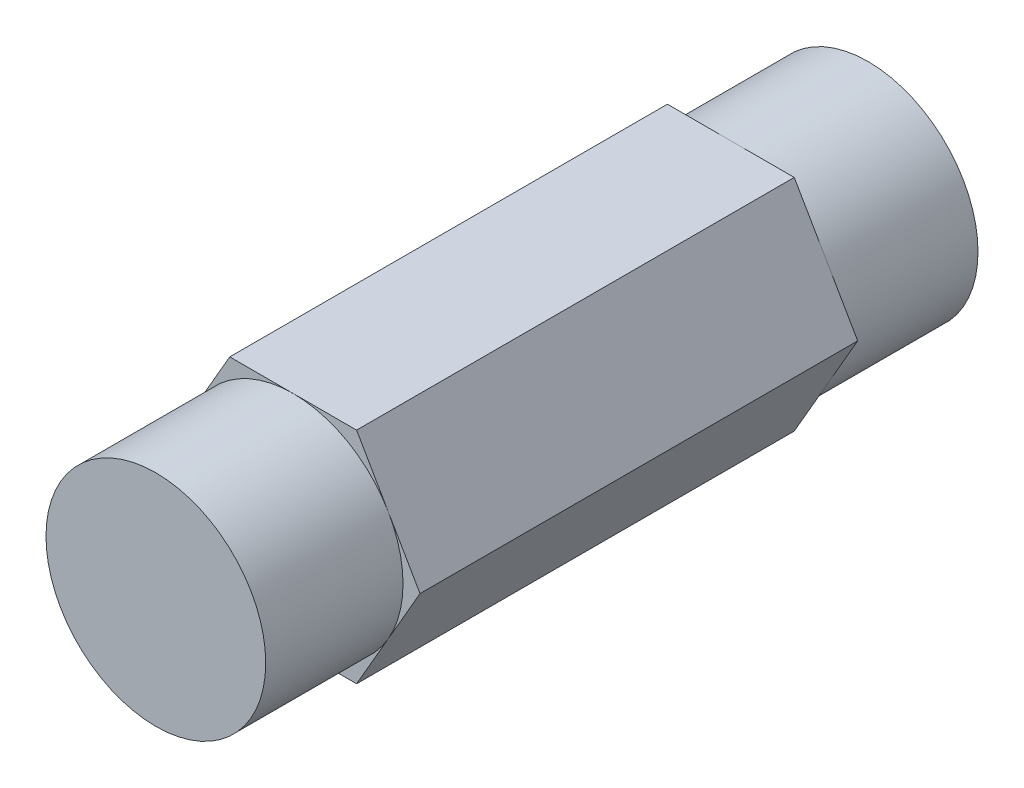
from build123d import *

# Parameters (mm, degrees)
SKETCH1_R           = 6.35
BOSS_EXTRUDE1_DEPTH = 7.9375
BOSS_EXTRUDE2_DEPTH = 25.2984
SKETCH3_R           = 6.35
BOSS_EXTRUDE3_DEPTH = 7.9375


with BuildPart() as part:
    # Sketch1 → Boss-Extrude1 (new body)
    with BuildSketch(Plane.XY):
        Circle(SKETCH1_R)
    extrude(amount=BOSS_EXTRUDE1_DEPTH)

    # Sketch2 → Boss-Extrude2 (add)
    with BuildSketch(Plane.XY.offset(7.9375)):
        Polygon((7.332348419, 0), (3.666174209, 6.35), (-3.666174209, 6.35), (-7.332348419, 0), (-3.666174209, -6.35), (3.666174209, -6.35), align=None)
    extrude(amount=BOSS_EXTRUDE2_DEPTH)

    # Sketch3 → Boss-Extrude3 (add)
    with BuildSketch(Plane.XY.offset(33.2359)):
        Circle(SKETCH3_R)
    extrude(amount=BOSS_EXTRUDE3_DEPTH)


solid = part.part
